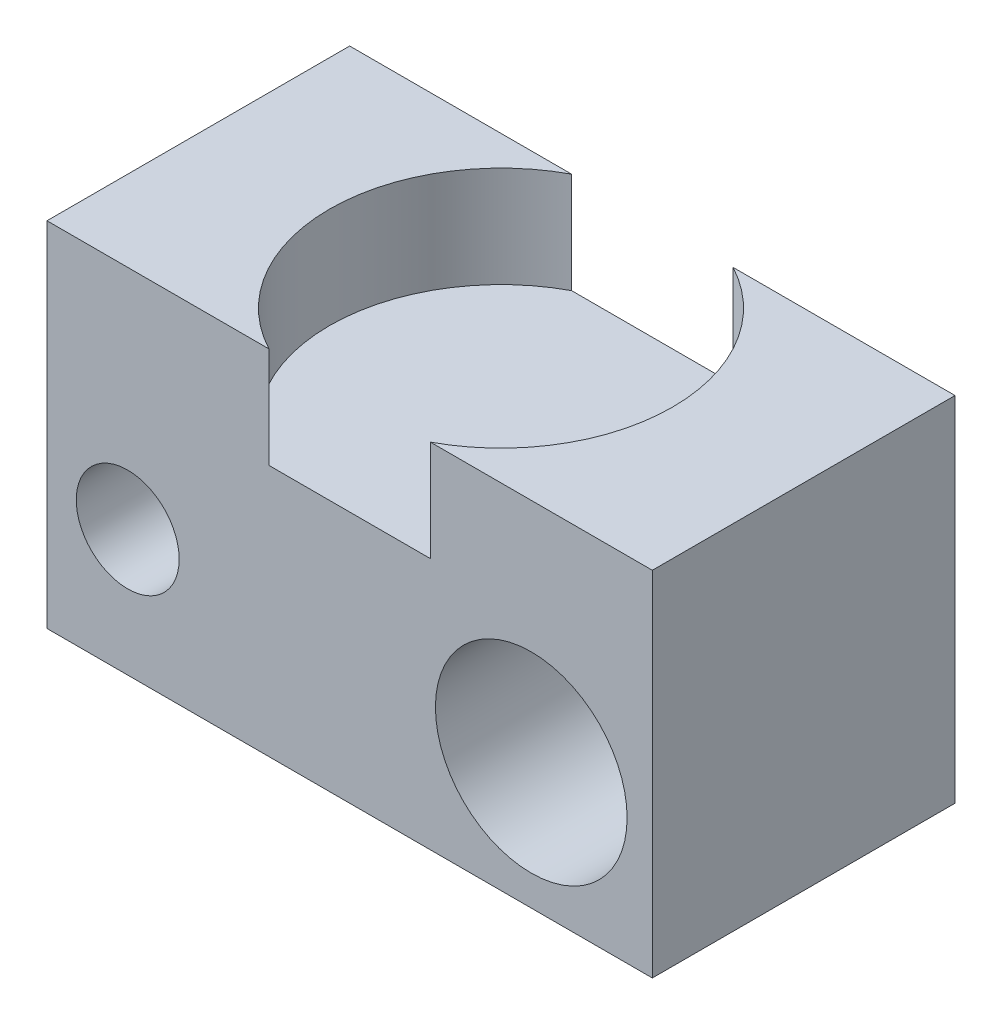
from build123d import *

# Parameters (mm, degrees)
SKETCH1_W           = 60
SKETCH1_H           = 25
SKETCH1_R           = 9.5
SKETCH1_R_2         = 5.1
BOSS_EXTRUDE1_DEPTH = 30
BOSS_EXTRUDE2_DEPTH = 10


with BuildPart() as part:
    # Sketch1 → Boss-Extrude1 (new body)
    with BuildSketch(Plane.XY):
        Rectangle(SKETCH1_W, SKETCH1_H)
        with Locations((18, 0)):
            Circle(SKETCH1_R, mode=Mode.SUBTRACT)
        with Locations((-22, 0)):
            Circle(SKETCH1_R_2, mode=Mode.SUBTRACT)
    extrude(amount=BOSS_EXTRUDE1_DEPTH)

    # Sketch2 → Boss-Extrude2 (add)
    with BuildSketch(Plane(origin=(0, 12.5, 0), x_dir=(1, 0, 0), z_dir=(0, 1, 0))):
        with BuildLine():
            ThreePointArc((8, 0), (17, -15), (8, -30))
            Line((8, -30), (30, -30))
            Line((30, -30), (30, 0))
            Line((30, 0), (8, 0))
        make_face()
        with BuildLine():
            ThreePointArc((-8, -30), (-17, -15), (-8, 0))
            Line((-8, 0), (-30, 0))
            Line((-30, 0), (-30, -30))
            Line((-30, -30), (-8, -30))
        make_face()
    extrude(amount=BOSS_EXTRUDE2_DEPTH)


solid = part.part
